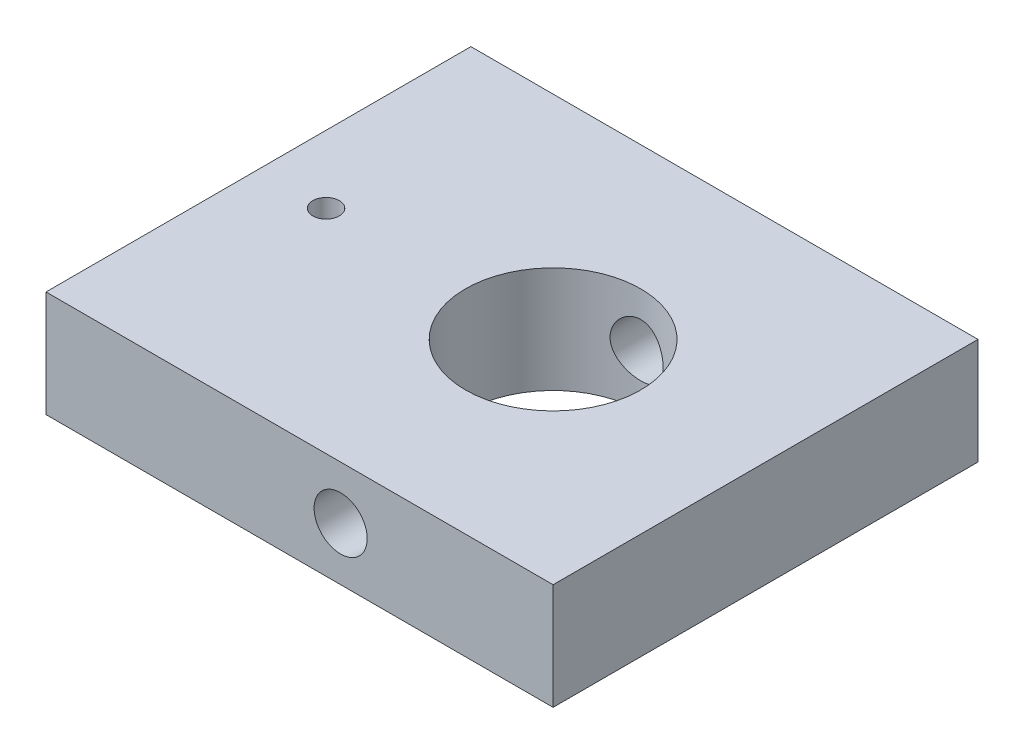
from build123d import *

# Parameters (mm, degrees)
SKETCH1_W           = 121.249023843
SKETCH1_H           = 101.6
SKETCH1_R           = 20.955
SKETCH1_R_2         = 3.175
BOSS_EXTRUDE1_DEPTH = 25.4
SKETCH2_R           = 6.35
CUT_EXTRUDE1_DEPTH  = 229.6


with BuildPart() as part:
    # Sketch1 → Boss-Extrude1 (new body)
    with BuildSketch(Plane(origin=(0, 0, 0), x_dir=(1, 0, 0), z_dir=(0, 1, 0))):
        with Locations((142.575488079, 50.8)):
            Rectangle(SKETCH1_W, SKETCH1_H)
        with Locations((152.4, 50.8)):
            Circle(SKETCH1_R, mode=Mode.SUBTRACT)
        with Locations((98.1075, 50.8)):
            Circle(SKETCH1_R_2, mode=Mode.SUBTRACT)
    extrude(amount=BOSS_EXTRUDE1_DEPTH)

    # Sketch2 → Cut-Extrude1 (cut, through all)
    with BuildSketch(Plane.XY):
        with Locations((152.4, 12.7)):
            Circle(SKETCH2_R)
    extrude(amount=-CUT_EXTRUDE1_DEPTH, mode=Mode.SUBTRACT)


solid = part.part
